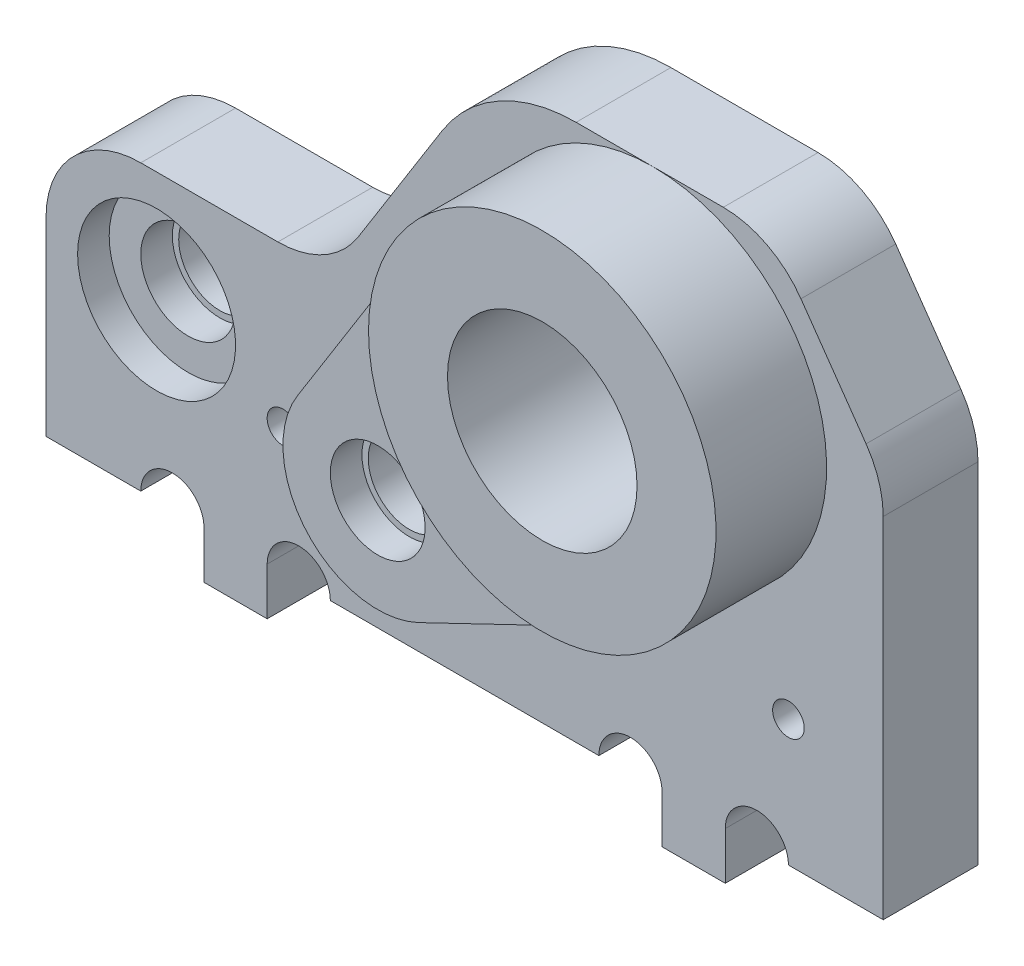
from build123d import *
from build123d.topology import SkipClean

# Parameters (mm, degrees)
SKETCH1_W                            = 26.5
SKETCH1_H                            = 6
BOSS_EXTRUDE1_DEPTH                  = 17
SKETCH2_R                            = 1.5
CUT_EXTRUDE1_DEPTH                   = 1
SKETCH3_R                            = 1.3
CUT_EXTRUDE2_DEPTH                   = 32.878676259
SKETCH4_R                            = 3
CUT_EXTRUDE3_DEPTH                   = 33.050741021
SKETCH5_R                            = 2.5
CUT_EXTRUDE4_DEPTH                   = 1.5
SKETCH6_R                            = 1.5
CUT_EXTRUDE8_DEPTH                   = 1
SKETCH7_R                            = 1.3
CUT_EXTRUDE9_DEPTH                   = 32.678068123
CUT_EXTRUDE10_START                  = -1
SKETCH8_R                            = 2.5
CUT_EXTRUDE10_DEPTH                  = 1
CUT_EXTRUDE11_START                  = -1
SKETCH9_R                            = 1.5
CUT_EXTRUDE11_DEPTH                  = 1
SKETCH10_R                           = 5.5
SKETCH10_R_2                         = 3
BOSS_EXTRUDE2_DEPTH                  = 3.5
SKETCH11_R                           = 3
SKETCH11_R_2                         = 1.3
BOSS_EXTRUDE4_DEPTH                  = 2
CUT_EXTRUDE12_START                  = -1
SKETCH12_R                           = 1.5
CUT_EXTRUDE12_DEPTH                  = 1
SKETCH17_W                           = 2
SKETCH17_H                           = 6
BOSS_EXTRUDE6_DEPTH                  = 1.5
SKETCH18_R                           = 1
CUT_EXTRUDE17_DEPTH                  = 33.050741021
CHAMFER2_SIZE                        = 5
CHAMFER2_SIZE2                       = 3.5
FILLET11_R                           = 3
BOSS_EXTRUDE7_DEPTH                  = 2
CUT_EXTRUDE19_DEPTH                  = 33.050741021
FILLET13_R                           = 5
FILLET14_R                           = 3
FILLET15_R                           = 3
SKIZZE1_R                            = 0.5
SCHNITT_LINEAR_AUSTRAGEN1_DEPTH      = 33.050741021
SPIEGELN1_OUTLINE_R                  = 3
SPIEGELN1_OUTLINE_R_2                = 2.5
SPIEGELN1_OUTLINE_R_3                = 0.5
SPIEGELN1_OUTLINE_R_4                = 1.5
SPIEGELN1_DEPTH                      = 6
SPIEGELN1_START                      = 6
SPIEGELN1_2_OUTLINE_R                = 5.5
SPIEGELN1_2_OUTLINE_R_2              = 3
SPIEGELN1_2_DEPTH                    = 3.5
SPIEGELN1_3_OUTLINE_R                = 1.5
SPIEGELN1_3_DEPTH                    = 2
SPIEGELN1_START_2                    = 1.5
SPIEGELN1_4_OUTLINE_R                = 1.5
SPIEGELN1_4_OUTLINE_R_2              = 1.3
SPIEGELN1_4_OUTLINE_R_3              = 2.5
SPIEGELN1_4_DEPTH                    = 3.5
SPIEGELN1_START_3                    = 1
SPIEGELN1_5_OUTLINE_R                = 1.5
SPIEGELN1_5_OUTLINE_R_2              = 1.3
SPIEGELN1_5_DEPTH                    = 6
SPIEGELN1_START_4                    = 2.5
SPIEGELN1_6_OUTLINE_R                = 1.5
SPIEGELN1_6_OUTLINE_R_2              = 1.3
SPIEGELN1_6_DEPTH                    = 1.5
SCHNITT_LINEAR_AUSTRAGEN2_DEPTH      = 31.409702399
SCHNITT_LINEAR_AUSTRAGEN2_DEPTH_BACK = 31.409702399
SKIZZE2_W                            = 26.5
SKIZZE2_H                            = 9.5
SCHNITT_LINEAR_AUSTRAGEN3_DEPTH      = 31.409702399
SCHNITT_LINEAR_AUSTRAGEN3_DEPTH_BACK = 31.409702399
SKIZZE3_W                            = 26.5
SKIZZE3_H                            = 3


# Read off the part's stored shape, not the designer's step: Spiegeln1
with BuildPart() as part:
    # Sketch1 → Boss-Extrude1 (new body)
    with BuildSketch(Plane(origin=(0, 0, 0), x_dir=(1, 0, 0), z_dir=(0, 1, 0))):
        with Locations((13.25, 3)):
            Rectangle(SKETCH1_W, SKETCH1_H)
    extrude(amount=BOSS_EXTRUDE1_DEPTH)

    # Sketch2 → Cut-Extrude1 (cut)
    with BuildSketch(Plane.XY):
        with Locations((12.5, 5.5)):
            Circle(SKETCH2_R)
    extrude(amount=-CUT_EXTRUDE1_DEPTH, mode=Mode.SUBTRACT)

    # Sketch3 → Cut-Extrude2 (cut, through all)
    with BuildSketch(Plane.XY.offset(-1)):
        with Locations((12.5, 5.5)):
            Circle(SKETCH3_R)
    extrude(amount=-CUT_EXTRUDE2_DEPTH, mode=Mode.SUBTRACT)

    # Sketch4 → Cut-Extrude3 (cut, through all)
    with BuildSketch(Plane.XY):
        with Locations((19.208203932, 11.5)):
            Circle(SKETCH4_R)
    extrude(amount=-CUT_EXTRUDE3_DEPTH, mode=Mode.SUBTRACT)

    # Sketch5 → Cut-Extrude4 (cut)
    with BuildSketch(Plane.XY):
        with Locations((3.5, 5.5)):
            Circle(SKETCH5_R)
    extrude(amount=-CUT_EXTRUDE4_DEPTH, mode=Mode.SUBTRACT)

    # Sketch6 → Cut-Extrude8 (cut)
    with BuildSketch(Plane.XY.offset(-1.5)):
        with Locations((3.5, 5.5)):
            Circle(SKETCH6_R)
    extrude(amount=-CUT_EXTRUDE8_DEPTH, mode=Mode.SUBTRACT)

    # Sketch7 → Cut-Extrude9 (cut, through all)
    with BuildSketch(Plane.XY.offset(-2.5)):
        with Locations((3.5, 5.5)):
            Circle(SKETCH7_R)
    extrude(amount=-CUT_EXTRUDE9_DEPTH, mode=Mode.SUBTRACT)

    # Sketch8 → Cut-Extrude10 (cut)
    with BuildSketch(Plane(origin=(0, 0, -6), x_dir=(-1, 0, 0), z_dir=(0, 0, -1)).offset(CUT_EXTRUDE10_START)):
        with Locations(Location((-3.5, 5.5, 0), (0, 0, 180))):
            Circle(SKETCH8_R)
    extrude(amount=CUT_EXTRUDE10_DEPTH, mode=Mode.SUBTRACT)

    # Sketch9 → Cut-Extrude11 (cut)
    with BuildSketch(Plane(origin=(0, 0, -5), x_dir=(-1, 0, 0), z_dir=(0, 0, -1)).offset(CUT_EXTRUDE11_START)):
        with Locations(Location((-3.5, 5.5, 0), (0, 0, 180))):
            Circle(SKETCH9_R)
    extrude(amount=CUT_EXTRUDE11_DEPTH, mode=Mode.SUBTRACT)

    # Sketch10 → Boss-Extrude2 (add)
    with BuildSketch(Plane(origin=(0, 0, -6), x_dir=(-1, 0, 0), z_dir=(0, 0, -1))):
        with Locations(Location((-19.208203932, 11.5, 0), (0, 0, 90))):
            Circle(SKETCH10_R)
        with Locations(Location((-19.208203932, 11.5, 0), (0, 0, 180))):
            Circle(SKETCH10_R_2, mode=Mode.SUBTRACT)
    extrude(amount=BOSS_EXTRUDE2_DEPTH)

    # Sketch11 → Boss-Extrude4 (add)
    with BuildSketch(Plane(origin=(0, 0, -6), x_dir=(-1, 0, 0), z_dir=(0, 0, -1))):
        with Locations(Location((-12.5, 5.5, 0), (0, 0, 180))):
            Circle(SKETCH11_R)
        with Locations(Location((-12.5, 5.5, 0), (0, 0, 180))):
            Circle(SKETCH11_R_2, mode=Mode.SUBTRACT)
    extrude(amount=BOSS_EXTRUDE4_DEPTH)

    # Sketch12 → Cut-Extrude12 (cut)
    with BuildSketch(Plane(origin=(0, 0, -8), x_dir=(-1, 0, 0), z_dir=(0, 0, -1)).offset(CUT_EXTRUDE12_START)):
        with Locations(Location((-12.5, 5.5, 0), (0, 0, 180))):
            Circle(SKETCH12_R)
    extrude(amount=CUT_EXTRUDE12_DEPTH, mode=Mode.SUBTRACT)

    # Sketch17 → Boss-Extrude6 (add)
    with BuildSketch(Plane.XZ):
        with Locations((6, -3)):
            Rectangle(SKETCH17_W, SKETCH17_H)
        with Locations((20.5, -3)):
            Rectangle(SKETCH17_W, SKETCH17_H)
    extrude(amount=BOSS_EXTRUDE6_DEPTH)

    # Sketch18 → Cut-Extrude17 (cut, through all)
    with BuildSketch(Plane(origin=(0, 0, -6), x_dir=(-1, 0, 0), z_dir=(0, 0, -1))):
        with Locations((-22.5, 0)):
            Circle(SKETCH18_R)
        with Locations((-18.5, 0)):
            Circle(SKETCH18_R)
        with Locations((-8, 0)):
            Circle(SKETCH18_R)
        with Locations((-4, 0)):
            Circle(SKETCH18_R)
    extrude(amount=-CUT_EXTRUDE17_DEPTH, mode=Mode.SUBTRACT)

    # Chamfer2
    chamfer2_edges = [part.edges().sort_by_distance(p)[0] for p in [
        (26.5, 17, -3),
    ]]
    chamfer2_side = [part.faces().sort_by_distance(p)[0] for p in [
        (26.5, 8.5, -3),
    ]]
    chamfer(chamfer2_edges, length=CHAMFER2_SIZE, length2=CHAMFER2_SIZE2, reference=chamfer2_side[0])

    # Fillet11
    fillet11_edges = [part.edges().sort_by_distance(p)[0] for p in [
        (23, 17, -3),
        (26.5, 12, -3),
    ]]
    fillet(fillet11_edges, radius=FILLET11_R)

    # Sketch19 → Boss-Extrude7 (add)
    with BuildSketch(Plane(origin=(0, 0, -6), x_dir=(-1, 0, 0), z_dir=(0, 0, -1))):
        with BuildLine():
            Line((-14.547099294, 14.419606745), (-9.957579288, 7.09251277))
            ThreePointArc((-9.957579288, 7.09251277), (-14.736067977, 7.5), (-13.800160725, 2.796376119))
            Line((-13.800160725, 2.796376119), (-21.591831928, 6.543356218))
            ThreePointArc((-21.591831928, 6.543356218), (-15.108745974, 7.833333333), (-14.547099294, 14.419606745))
        make_face()
    extrude(amount=BOSS_EXTRUDE7_DEPTH)

    # Sketch20 → Cut-Extrude19 (cut, through all)
    with BuildSketch(Plane(origin=(0, 0, -6), x_dir=(-1, 0, 0), z_dir=(0, 0, -1))):
        Polygon((0, 17), (-14.011012575, 17), (-9, 9), (0, 9), align=None)
    extrude(amount=-CUT_EXTRUDE19_DEPTH, mode=Mode.SUBTRACT)

    # Fillet13
    fillet13_edges = [part.edges().sort_by_distance(p)[0] for p in [
        (14.011012575, 17, -3),
    ]]
    fillet(fillet13_edges, radius=FILLET13_R)

    # Fillet14
    fillet14_edges = [part.edges().sort_by_distance(p)[0] for p in [
        (9, 9, -3),
    ]]
    fillet(fillet14_edges, radius=FILLET14_R)

    # Fillet15
    fillet15_edges = [part.edges().sort_by_distance(p)[0] for p in [
        (0, 9, -3),
    ]]
    fillet(fillet15_edges, radius=FILLET15_R)

    # Skizze1 → Schnitt-Linear austragen1 (cut, through all)
    with BuildSketch(Plane(origin=(0, 0, -6), x_dir=(-1, 0, 0), z_dir=(0, 0, -1))):
        with Locations((-23.5, 4)):
            Circle(SKIZZE1_R)
        with Locations((-7.5, 4)):
            Circle(SKIZZE1_R)
    extrude(amount=-SCHNITT_LINEAR_AUSTRAGEN1_DEPTH, mode=Mode.SUBTRACT)

    # Spiegeln1 outline → Spiegeln1 (add)
    with SkipClean():  # the faces are left unmerged after this step: merging them gives an invalid solid
        with BuildSketch(Plane.XY):
            with BuildLine():
                Line((21.438033315, 17), (16.779018718, 17))
                ThreePointArc((16.779018718, 17), (14.357339523, 16.374410803), (12.541650865, 14.65418795))
                Line((12.541650865, 14.65418795), (9.881617026, 10.40748723))
                ThreePointArc((9.881617026, 10.40748723), (8.792203831, 9.375353518), (7.339196314, 9))
                Line((7.339196314, 9), (3, 9))
                ThreePointArc((3, 9), (0.878679656, 8.121320344), (0, 6))
                Line((0, 6), (0, 0))
                Line((0, 0), (3, 0))
                ThreePointArc((3, 0), (4, 1), (5, 0))
                Line((5, 0), (5, -1.5))
                Line((5, -1.5), (7, -1.5))
                Line((7, -1.5), (7, 0))
                ThreePointArc((7, 0), (8, 1), (9, 0))
                Line((9, 0), (17.5, 0))
                ThreePointArc((17.5, 0), (18.5, 1), (19.5, 0))
                Line((19.5, 0), (19.5, -1.5))
                Line((19.5, -1.5), (21.5, -1.5))
                Line((21.5, -1.5), (21.5, 0))
                ThreePointArc((21.5, 0), (22.5, 1), (23.5, 0))
                Line((23.5, 0), (26.5, 0))
                Line((26.5, 0), (26.5, 11.054333308))
                ThreePointArc((26.5, 11.054333308), (26.361213666, 11.956251462), (25.957695762, 12.774720341))
                Line((25.957695762, 12.774720341), (23.895729077, 15.720387033))
                ThreePointArc((23.895729077, 15.720387033), (22.823464458, 16.660936029), (21.438033315, 17))
            make_face()
            with Locations((19.208203932, 11.5)):
                Circle(SPIEGELN1_OUTLINE_R, mode=Mode.SUBTRACT)
            with Locations((3.5, 5.5)):
                Circle(SPIEGELN1_OUTLINE_R_2, mode=Mode.SUBTRACT)
            with Locations((7.5, 4)):
                Circle(SPIEGELN1_OUTLINE_R_3, mode=Mode.SUBTRACT)
            with Locations((23.5, 4)):
                Circle(SPIEGELN1_OUTLINE_R_3, mode=Mode.SUBTRACT)
            with Locations((12.5, 5.5)):
                Circle(SPIEGELN1_OUTLINE_R_4, mode=Mode.SUBTRACT)
        extrude(amount=SPIEGELN1_DEPTH)

    # Spiegeln1 2 outline → Spiegeln1 2 (add)
    with SkipClean():  # the faces are left unmerged after this step: merging them gives an invalid solid
        with BuildSketch(Plane.XY.offset(SPIEGELN1_START)):
            with Locations((19.208203932, 11.5)):
                Circle(SPIEGELN1_2_OUTLINE_R)
            with Locations((19.208203932, 11.5)):
                Circle(SPIEGELN1_2_OUTLINE_R_2, mode=Mode.SUBTRACT)
        extrude(amount=SPIEGELN1_2_DEPTH)

    # Spiegeln1 3 outline → Spiegeln1 3 (add)
    with SkipClean():  # the faces are left unmerged after this step: merging them gives an invalid solid
        with BuildSketch(Plane.XY.offset(SPIEGELN1_START)):
            with BuildLine():
                ThreePointArc((21.591831928, 6.543356218), (15.108745973, 7.833333333), (14.547099293, 14.419606745))
                Line((14.547099293, 14.419606745), (9.957579288, 7.09251277))
                ThreePointArc((9.957579288, 7.09251277), (10.263932023, 3.5), (13.800160725, 2.796376119))
                Line((13.800160725, 2.796376119), (21.591831928, 6.543356218))
            make_face()
            with Locations((12.5, 5.5)):
                Circle(SPIEGELN1_3_OUTLINE_R, mode=Mode.SUBTRACT)
        extrude(amount=SPIEGELN1_3_DEPTH)

    # Spiegeln1 4 outline → Spiegeln1 4 (add)
    # profile 1 of 2: a face of its own
    with SkipClean():  # the faces are left unmerged after this step: merging them gives an invalid solid
        with BuildSketch(Plane.XY.offset(SPIEGELN1_START_2)):
            with Locations((12.5, 5.5)):
                Circle(SPIEGELN1_4_OUTLINE_R)
            with Locations((12.5, 5.5)):
                Circle(SPIEGELN1_4_OUTLINE_R_2, mode=Mode.SUBTRACT)
        # profile 2 of 2: a face of its own
        with BuildSketch(Plane.XY.offset(SPIEGELN1_START_2)):
            with Locations((3.5, 5.5)):
                Circle(SPIEGELN1_4_OUTLINE_R_3)
            with Locations((3.5, 5.5)):
                Circle(SPIEGELN1_4_OUTLINE_R, mode=Mode.SUBTRACT)
        extrude(amount=SPIEGELN1_4_DEPTH)

    # Spiegeln1 5 outline → Spiegeln1 5 (add)
    with SkipClean():  # the faces are left unmerged after this step: merging them gives an invalid solid
        with BuildSketch(Plane.XY.offset(SPIEGELN1_START_3)):
            with Locations((12.5, 5.5)):
                Circle(SPIEGELN1_5_OUTLINE_R)
            with Locations((12.5, 5.5)):
                Circle(SPIEGELN1_5_OUTLINE_R_2, mode=Mode.SUBTRACT)
        extrude(amount=SPIEGELN1_5_DEPTH)

    # Spiegeln1 6 outline → Spiegeln1 6 (add)
    with SkipClean():  # the faces are left unmerged after this step: merging them gives an invalid solid
        with BuildSketch(Plane.XY.offset(SPIEGELN1_START_4)):
            with Locations((3.5, 5.5)):
                Circle(SPIEGELN1_6_OUTLINE_R)
            with Locations((3.5, 5.5)):
                Circle(SPIEGELN1_6_OUTLINE_R_2, mode=Mode.SUBTRACT)
        extrude(amount=SPIEGELN1_6_DEPTH)

    # Skizze2 → Schnitt-Linear austragen2 (cut, two sides: drawn at the far end of the back side and taken through both)
    with BuildSketch(Plane(origin=(0, 5.5, 0), x_dir=(1, 0, 0), z_dir=(0, 1, 0)).offset(-SCHNITT_LINEAR_AUSTRAGEN2_DEPTH_BACK)):
        with Locations((13.25, 4.75)):
            Rectangle(SKIZZE2_W, SKIZZE2_H)
    extrude(amount=SCHNITT_LINEAR_AUSTRAGEN2_DEPTH + SCHNITT_LINEAR_AUSTRAGEN2_DEPTH_BACK, mode=Mode.SUBTRACT)

    # Skizze3 → Schnitt-Linear austragen3 (cut, two sides: drawn at the far end of the back side and taken through both)
    with BuildSketch(Plane(origin=(0, 5.5, 0), x_dir=(1, 0, 0), z_dir=(0, 1, 0)).offset(-SCHNITT_LINEAR_AUSTRAGEN3_DEPTH_BACK)):
        with Locations((13.25, -1.5)):
            Rectangle(SKIZZE3_W, SKIZZE3_H)
    extrude(amount=SCHNITT_LINEAR_AUSTRAGEN3_DEPTH + SCHNITT_LINEAR_AUSTRAGEN3_DEPTH_BACK, mode=Mode.SUBTRACT)


solid = part.part
